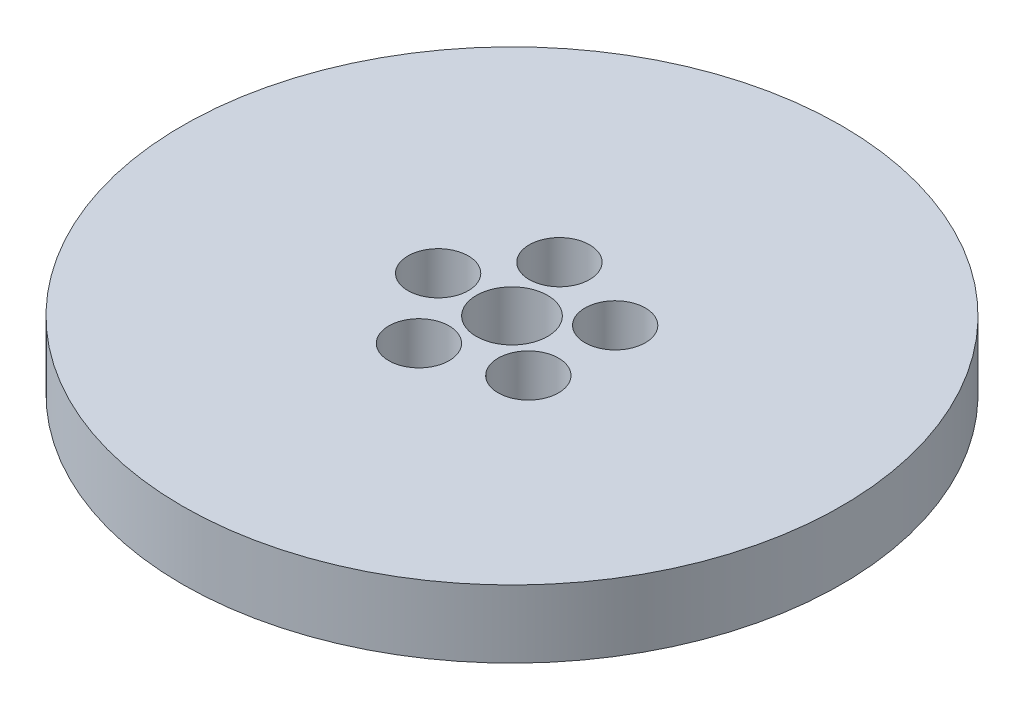
from build123d import *

# Parameters (mm, degrees)
SKETCH1_R           = 92.5
BOSS_EXTRUDE1_DEPTH = 19
SKETCH2_R           = 10
CUT_EXTRUDE1_DEPTH  = 133.187367021
SKETCH3_R           = 8.470706467
CUT_EXTRUDE2_DEPTH  = 12.574196361
CIRPATTERN1_COUNT   = 5


with BuildPart() as part:
    # Sketch1 → Boss-Extrude1 (new body)
    with BuildSketch(Plane(origin=(0, 0, 0), x_dir=(1, 0, 0), z_dir=(0, 1, 0))):
        Circle(SKETCH1_R)
    extrude(amount=BOSS_EXTRUDE1_DEPTH)

    # Sketch2 → Cut-Extrude1 (cut, through all)
    with BuildSketch(Plane(origin=(0, 0, 0), x_dir=(1, 0, 0), z_dir=(0, 1, 0))):
        Circle(SKETCH2_R)
    extrude(amount=CUT_EXTRUDE1_DEPTH, mode=Mode.SUBTRACT)

    # Sketch3 → Cut-Extrude2 (cut)
    with BuildSketch(Plane(origin=(0, 19, 0), x_dir=(1, 0, 0), z_dir=(0, 1, 0))):
        with Locations((-20.73140125, 0)):
            Circle(SKETCH3_R)
    cut_extrude2 = extrude(amount=-CUT_EXTRUDE2_DEPTH, mode=Mode.SUBTRACT)

    # CirPattern1: Cut-Extrude2 ×5 about axis
    cirpattern1_axis = Axis((0, 0, 0), (0, 1, 0))
    for i in range(1, CIRPATTERN1_COUNT):
        add(cut_extrude2.rotate(cirpattern1_axis, i * 360 / CIRPATTERN1_COUNT), mode=Mode.SUBTRACT)


solid = part.part
